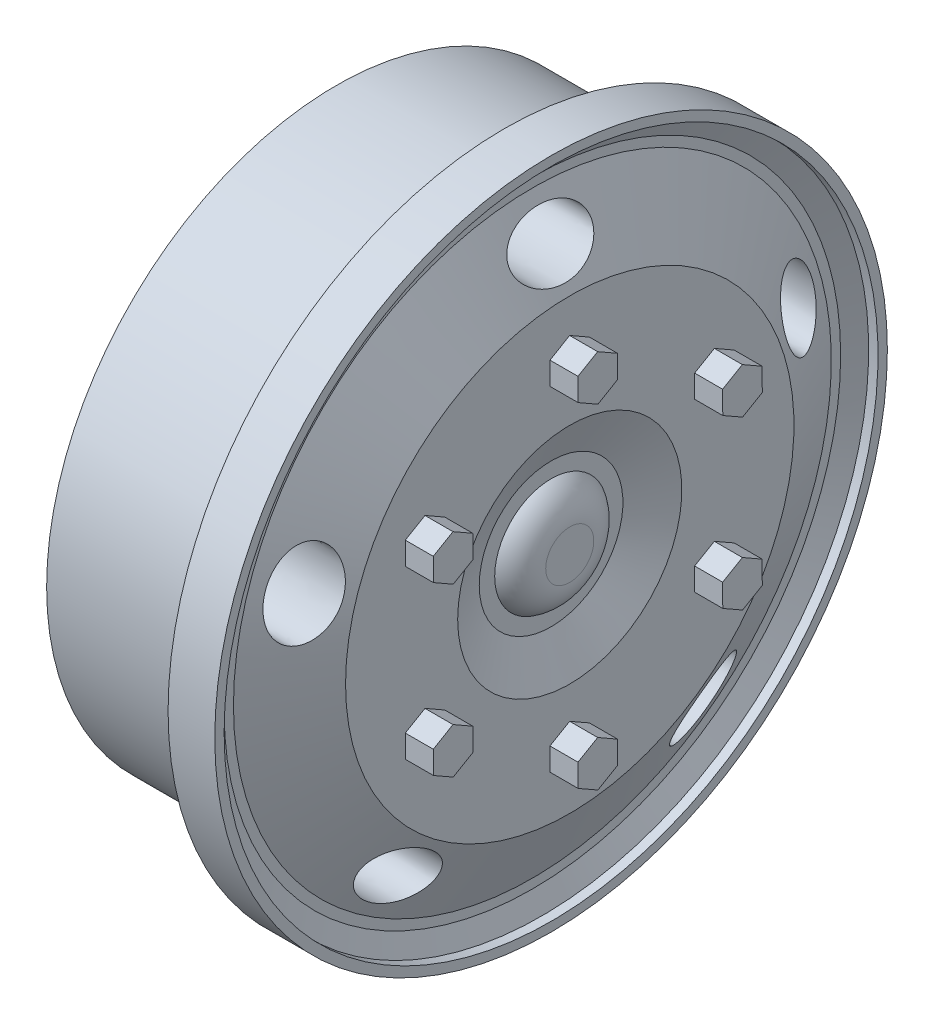
from build123d import *

# Parameters (mm, degrees)
SKETCH3_RX          = 2.216625444
SKETCH3_RY          = 1.445625289
CUT_EXTRUDE1_DEPTH  = 5
FILLET1_R           = 2
BOSS_EXTRUDE1_DEPTH = 1.5


with BuildPart() as part:
    # Sketch1 → Revolve1 (revolve)
    with BuildSketch(Plane(origin=(0, 0, 0), x_dir=(1, 0, 0), z_dir=(0, 1, 0)), mode=Mode.PRIVATE) as revolve1_sk:
        Polygon((5.5, 0), (-5.5, 0), (-5.5, 15.5), (3.5, 15.5), (3.5, 18), (5.5, 18), (6, 18), (6, 17.5), (5.5, 17.5), (5, 16.5), (5, 16), (7, 12), (7, 6), (6, 3.845161331), (6, 3.018549032), (7, 2.554477167), (7, 0), align=None)
    revolve(revolve1_sk.sketch.rotate(Axis((-25, 0, 0), (1, 0, 0)), 180), axis=Axis((-25, 0, 0), (1, 0, 0)))

    # Sketch3 → Cut-Extrude1 (cut, symmetric)
    with BuildSketch(Plane(origin=(7, 0, 0), x_dir=(0, 0, -1), z_dir=(1, 0, 0))):
        with Locations(Location((0, 13.926190288), (0, 0, 0))):
            Ellipse(SKETCH3_RX, SKETCH3_RY)
        with Locations(Location((13.244594021, 4.303429466), (0, 0, 108))):
            Ellipse(SKETCH3_RX, SKETCH3_RY)
        with Locations(Location((8.185609272, -11.26652461), (0, 0, 36))):
            Ellipse(SKETCH3_RX, SKETCH3_RY)
        with Locations(Location((-8.185609272, -11.26652461), (0, 0, -36))):
            Ellipse(SKETCH3_RX, SKETCH3_RY)
        with Locations(Location((-13.244594021, 4.303429466), (0, 0, 72))):
            Ellipse(SKETCH3_RX, SKETCH3_RY)
    extrude(amount=CUT_EXTRUDE1_DEPTH, both=True, mode=Mode.SUBTRACT)

    # Fillet1
    # the kernel refuses this fillet: 2 mm, written as the material it takes off along each edge
    with BuildSketch(Plane(origin=(7, 0, 0), x_dir=(0, 0, 1), z_dir=(0, 1, 0))) as fillet1_piece_1:
        with BuildLine():
            CenterArc((1.286498225, -2), FILLET1_R, 30, 60)
            Line((1.286498225, 0), (1.286498225, 0.04))
            Line((1.286498225, 0.04), (2.554477167, 0.04))
            Line((2.554477167, 0.04), (2.590760489, 0.016838069))
            ThreePointArc((2.590760489, 0.016838069), (2.822796422, -0.483161931), (3.053190048, -0.98))
            Line((3.053190048, -0.98), (3.018549032, -1))
        make_face()
    revolve(axis=Axis((7, 0, 0), (1, 0, 0)), mode=Mode.SUBTRACT)

    # Sketch4 → Boss-Extrude1 (add)
    with BuildSketch(Plane(origin=(7, 0, 0), x_dir=(0, 0, -1), z_dir=(1, 0, 0))):
        Polygon((7.749630704, 3.250124219), (8.80400944, 3.865505525), (8.798262965, 5.086314949), (7.738137753, 5.691743068), (6.683759016, 5.076361762), (6.689505491, 3.855552338), align=None)
        Polygon((1.060125212, 8.336439169), (1.054378737, 9.557248593), (-0.005746475, 10.162676712), (-1.060125212, 9.547295406), (-1.054378737, 8.326485982), (0.005746475, 7.721057863), align=None)
        Polygon((6.689505491, -5.086314949), (7.749630704, -5.691743068), (8.80400944, -5.076361762), (8.798262965, -3.855552338), (7.738137753, -3.250124219), (6.683759016, -3.865505525), align=None)
        Polygon((-1.060125212, -8.336439169), (-1.054378737, -9.557248593), (0.005746475, -10.162676712), (1.060125212, -9.547295406), (1.054378737, -8.326485982), (-0.005746475, -7.721057863), align=None)
        Polygon((-7.749630704, -3.250124219), (-8.80400944, -3.865505525), (-8.798262965, -5.086314949), (-7.738137753, -5.691743068), (-6.683759016, -5.076361762), (-6.689505491, -3.855552338), align=None)
        Polygon((-6.689505491, 5.086314949), (-7.749630704, 5.691743068), (-8.80400944, 5.076361762), (-8.798262965, 3.855552338), (-7.738137753, 3.250124219), (-6.683759016, 3.865505525), align=None)
    extrude(amount=BOSS_EXTRUDE1_DEPTH)


solid = part.part
